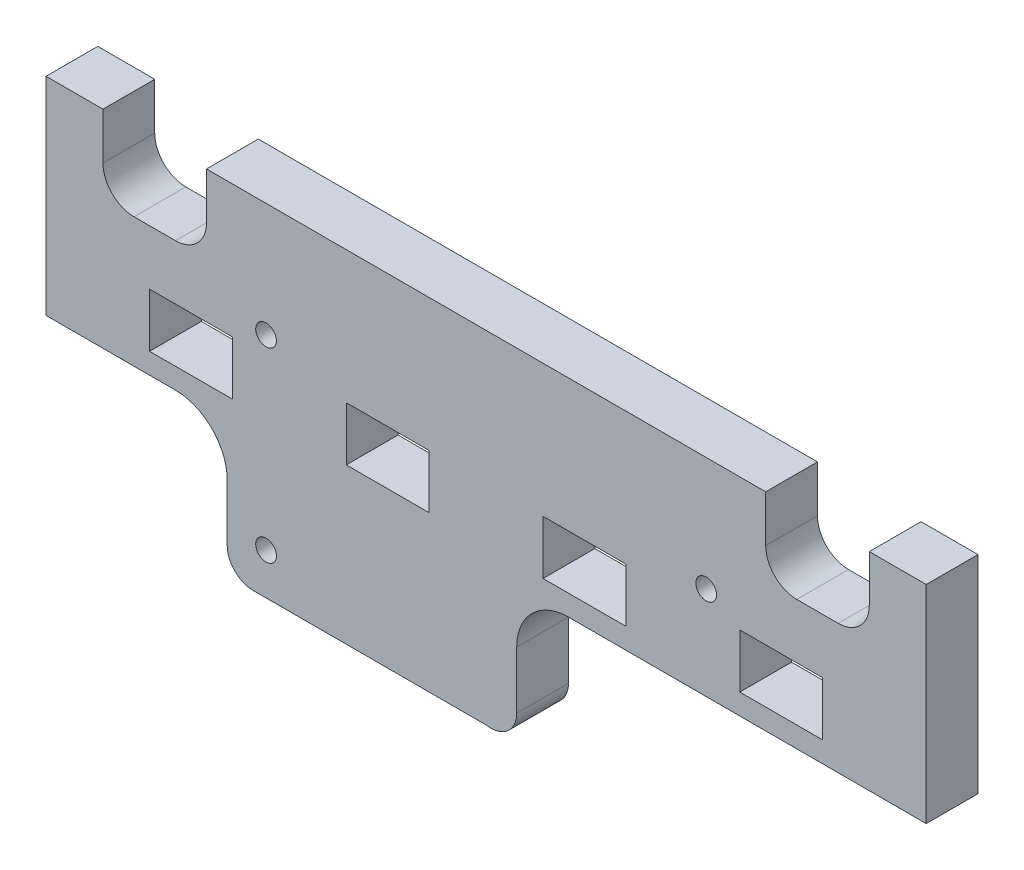
from build123d import *

# Parameters (mm, degrees)
BOSS_EXTRUDE1_DEPTH = 5
CUT_EXTRUDE1_REACH  = 64.525
SKETCH2_W           = 8
SKETCH2_H           = 5.2
CUT_EXTRUDE2_REACH  = 64.525
CUT_EXTRUDE3_REACH  = 64.525
SKETCH5_R           = 1


with BuildPart() as part:
    # Sketch1 → Boss-Extrude1 (new body)
    with BuildSketch(Plane.XY):
        with BuildLine():
            Line((24.485627442, 0), (59.028766582, 0))
            Line((59.028766582, 0), (59.028766582, 20))
            Line((59.028766582, 20), (-25.971233418, 20))
            Line((-25.971233418, 20), (-25.971233418, 0))
            Line((-25.971233418, 0), (-13.471233418, 0))
            ThreePointArc((-13.471233418, 0), (-9.935699512, -1.464466094), (-8.471233418, -5))
            Line((-8.471233418, -5), (-8.471233418, -10.5))
            ThreePointArc((-8.471233418, -10.5), (-7.739000371, -12.267766953), (-5.971233418, -13))
            Line((-5.971233418, -13), (16.528766582, -13))
            ThreePointArc((16.528766582, -13), (18.58372754, -12.464616991), (19.485627442, -10.542098831))
            Line((19.485627442, -10.542098831), (19.485627442, -5))
            ThreePointArc((19.485627442, -5), (20.950093536, -1.464466094), (24.485627442, 0))
        make_face()
    extrude(amount=BOSS_EXTRUDE1_DEPTH)

    # Sketch2 → Cut-Extrude1 (cut, up to next)
    with BuildSketch(Plane.XY.offset(5), mode=Mode.PRIVATE) as cut_extrude1_sk1:
        with Locations((-11.971233418, 4.6)):
            Rectangle(SKETCH2_W, SKETCH2_H)
    cut_extrude1_tool1 = extrude(cut_extrude1_sk1.sketch, amount=-CUT_EXTRUDE1_REACH, mode=Mode.PRIVATE) & part.part
    # Sketch2 → Cut-Extrude1 (cut, up to next)
    with BuildSketch(Plane.XY.offset(5), mode=Mode.PRIVATE) as cut_extrude1_sk2:
        with Locations((7.028766582, 4.6)):
            Rectangle(SKETCH2_W, SKETCH2_H)
    cut_extrude1_tool2 = extrude(cut_extrude1_sk2.sketch, amount=-CUT_EXTRUDE1_REACH, mode=Mode.PRIVATE) & part.part
    # Sketch2 → Cut-Extrude1 (cut, up to next)
    with BuildSketch(Plane.XY.offset(5), mode=Mode.PRIVATE) as cut_extrude1_sk3:
        with Locations((26.028766582, 4.6)):
            Rectangle(SKETCH2_W, SKETCH2_H)
    cut_extrude1_tool3 = extrude(cut_extrude1_sk3.sketch, amount=-CUT_EXTRUDE1_REACH, mode=Mode.PRIVATE) & part.part
    # Sketch2 → Cut-Extrude1 (cut, up to next)
    with BuildSketch(Plane.XY.offset(5), mode=Mode.PRIVATE) as cut_extrude1_sk4:
        with Locations((45.028766582, 4.6)):
            Rectangle(SKETCH2_W, SKETCH2_H)
    cut_extrude1_tool4 = extrude(cut_extrude1_sk4.sketch, amount=-CUT_EXTRUDE1_REACH, mode=Mode.PRIVATE) & part.part
    add(cut_extrude1_tool1.solids().sort_by_distance((-11.971233, 4.6, 5))[0], mode=Mode.SUBTRACT)
    add(cut_extrude1_tool2.solids().sort_by_distance((7.028767, 4.6, 5))[0], mode=Mode.SUBTRACT)
    add(cut_extrude1_tool3.solids().sort_by_distance((26.028767, 4.6, 5))[0], mode=Mode.SUBTRACT)
    add(cut_extrude1_tool4.solids().sort_by_distance((45.028767, 4.6, 5))[0], mode=Mode.SUBTRACT)

    # Sketch3 → Cut-Extrude2 (cut, up to next)
    with BuildSketch(Plane.XY.offset(5), mode=Mode.PRIVATE) as cut_extrude2_sk1:
        with BuildLine():
            Line((-20.471233418, 20), (-10.471233418, 20))
            Line((-10.471233418, 20), (-10.471233418, 15.5))
            ThreePointArc((-10.471233418, 15.5), (-11.349913074, 13.378679656), (-13.471233418, 12.5))
            Line((-13.471233418, 12.5), (-17.471233418, 12.5))
            ThreePointArc((-17.471233418, 12.5), (-19.592553762, 13.378679656), (-20.471233418, 15.5))
            Line((-20.471233418, 15.5), (-20.471233418, 20))
        make_face()
    cut_extrude2_tool1 = extrude(cut_extrude2_sk1.sketch, amount=-CUT_EXTRUDE2_REACH, mode=Mode.PRIVATE) & part.part
    cut_extrude2 = cut_extrude2_tool1.solids().sort_by_distance((-15.471233, 16.417242, 5))[0]
    add(cut_extrude2, mode=Mode.SUBTRACT)

    # Mirror1: Cut-Extrude2 across plane
    add(cut_extrude2.mirror(Plane(origin=(16.528766582, 0, 0), x_dir=(0, 0, 1), z_dir=(1, 0, 0))), mode=Mode.SUBTRACT)

    # Sketch5 → Cut-Extrude3 (cut, up to next)
    with BuildSketch(Plane.XY.offset(5), mode=Mode.PRIVATE) as cut_extrude3_sk1:
        with Locations((-4.721233418, 9)):
            Circle(SKETCH5_R)
    cut_extrude3_tool1 = extrude(cut_extrude3_sk1.sketch, amount=-CUT_EXTRUDE3_REACH, mode=Mode.PRIVATE) & part.part
    # Sketch5 → Cut-Extrude3 (cut, up to next)
    with BuildSketch(Plane.XY.offset(5), mode=Mode.PRIVATE) as cut_extrude3_sk2:
        with Locations((37.778766582, 9)):
            Circle(SKETCH5_R)
    cut_extrude3_tool2 = extrude(cut_extrude3_sk2.sketch, amount=-CUT_EXTRUDE3_REACH, mode=Mode.PRIVATE) & part.part
    # Sketch5 → Cut-Extrude3 (cut, up to next)
    with BuildSketch(Plane.XY.offset(5), mode=Mode.PRIVATE) as cut_extrude3_sk3:
        with Locations((-4.721233418, -9)):
            Circle(SKETCH5_R)
    cut_extrude3_tool3 = extrude(cut_extrude3_sk3.sketch, amount=-CUT_EXTRUDE3_REACH, mode=Mode.PRIVATE) & part.part
    add(cut_extrude3_tool1.solids().sort_by_distance((-4.721233, 9, 5))[0], mode=Mode.SUBTRACT)
    add(cut_extrude3_tool2.solids().sort_by_distance((37.778767, 9, 5))[0], mode=Mode.SUBTRACT)
    add(cut_extrude3_tool3.solids().sort_by_distance((-4.721233, -9, 5))[0], mode=Mode.SUBTRACT)


solid = part.part
